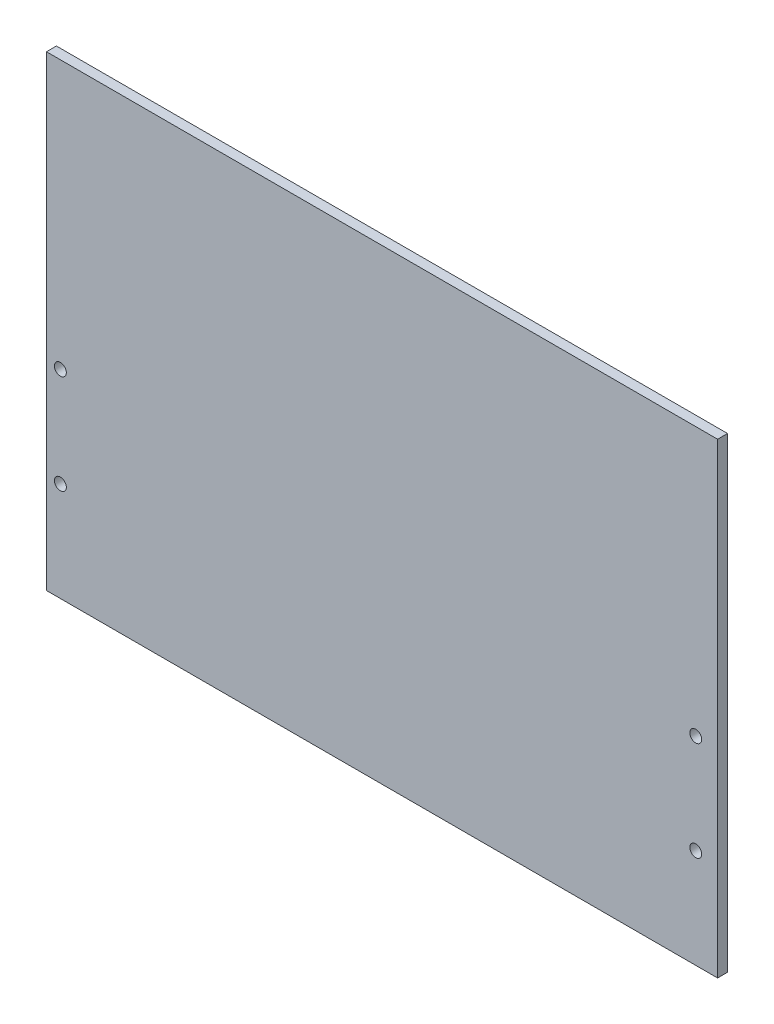
from build123d import *

# Parameters (mm, degrees)
SKETCH1_W           = 338
SKETCH1_H           = 235
SKETCH1_R           = 3
BOSS_EXTRUDE1_DEPTH = 5


with BuildPart() as part:
    # Sketch1 → Boss-Extrude1 (new body)
    with BuildSketch(Plane.XY):
        Rectangle(SKETCH1_W, SKETCH1_H)
        with Locations((-162, -67.5)):
            Circle(SKETCH1_R, mode=Mode.SUBTRACT)
        with Locations((-162, -17.5)):
            Circle(SKETCH1_R, mode=Mode.SUBTRACT)
        with Locations((158, -17.5)):
            Circle(SKETCH1_R, mode=Mode.SUBTRACT)
        with Locations((158, -67.5)):
            Circle(SKETCH1_R, mode=Mode.SUBTRACT)
    extrude(amount=BOSS_EXTRUDE1_DEPTH)


solid = part.part
